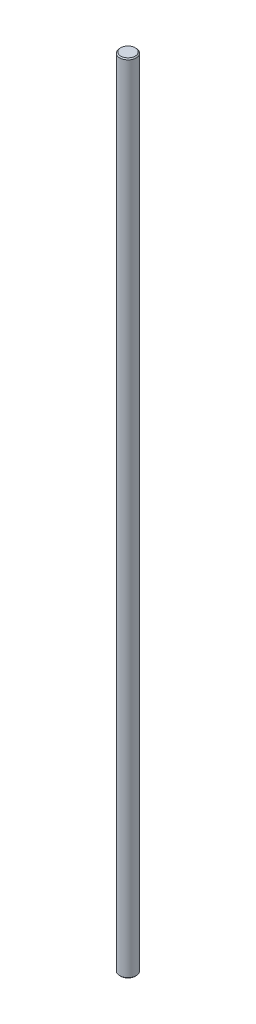
from build123d import *

# Parameters (mm, degrees)
SKETCH1_R           = 3.95
BOSS_EXTRUDE1_DEPTH = 380
CHAMFER1_SIZE       = 0.5
CHAMFER2_SIZE       = 0.5


with BuildPart() as part:
    # Sketch1 → Boss-Extrude1 (new body)
    with BuildSketch(Plane(origin=(0, 0, 0), x_dir=(1, 0, 0), z_dir=(0, 1, 0))):
        Circle(SKETCH1_R)
    extrude(amount=BOSS_EXTRUDE1_DEPTH)

    # Chamfer1
    chamfer1_edges = [part.edges().sort_by_distance(p)[0] for p in [
        (-3.95, 380, 0),
    ]]
    chamfer(chamfer1_edges, length=CHAMFER1_SIZE)

    # Chamfer2
    chamfer2_edges = [part.edges().sort_by_distance(p)[0] for p in [
        (-3.95, 0, 0),
    ]]
    chamfer(chamfer2_edges, length=CHAMFER2_SIZE)


solid = part.part
